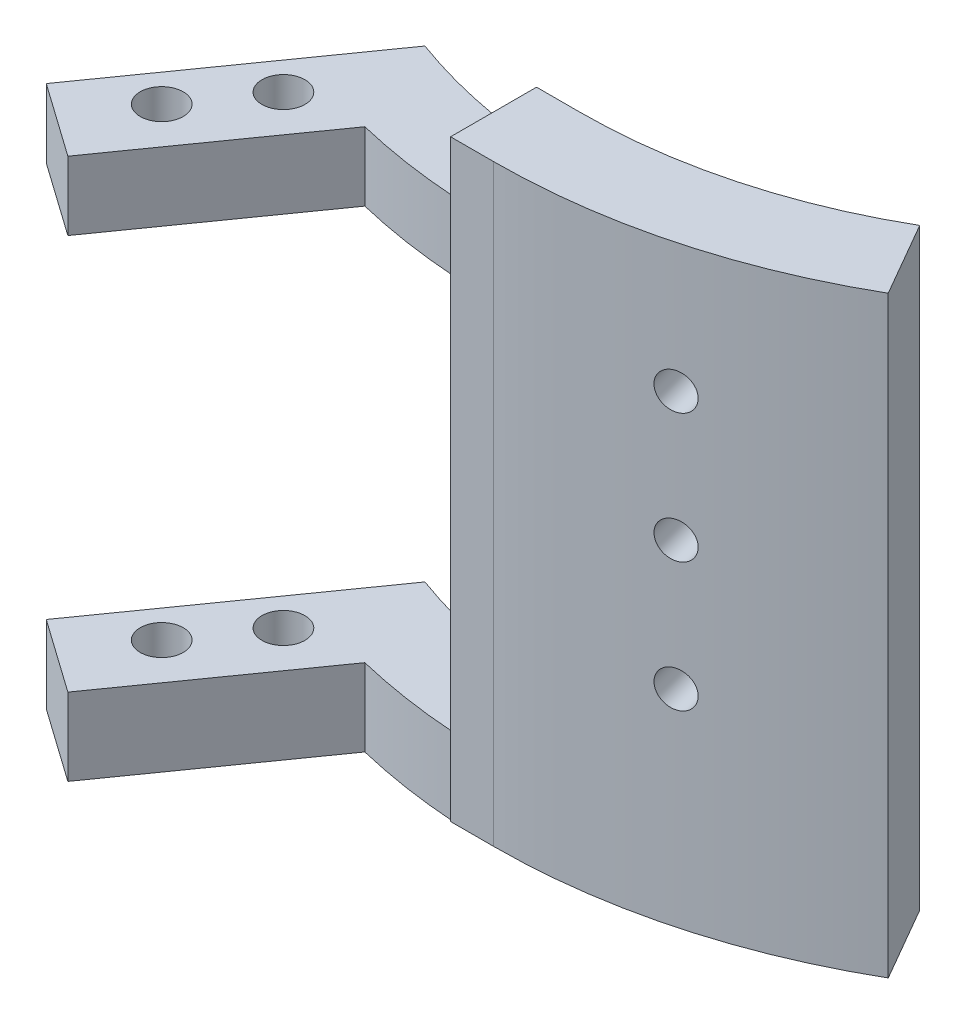
from build123d import *

# Parameters (mm, degrees)
BOSS_EXTRUDE2_DEPTH = 20
FILLET1_RADIUS      = 10
FILLET1_LENGTH      = 5
FILLET2_RADIUS      = 10
FILLET2_LENGTH      = 5
SKETCH5_R           = 1
SKETCH5_R_2         = 5.5
CUT_EXTRUDE5_DEPTH  = 69.007352544
CUT_EXTRUDE7_DEPTH  = 25
FILLET5_R           = 10
BOSS_EXTRUDE5_DEPTH = 60
SKETCH13_R          = 2.1
CUT_EXTRUDE8_DEPTH  = 60
CUT_EXTRUDE9_DEPTH  = 60
CUT_EXTRUDE10_DEPTH = 60
SKETCH17_R          = 2.5
BOSS_EXTRUDE6_DEPTH = 8
SKETCH18_R          = 2.5
BOSS_EXTRUDE7_DEPTH = 9


with BuildPart() as part:
    # Sketch1 → Boss-Extrude2 (new body)
    with BuildSketch(Plane.XY):
        Polygon((-25, 30), (25, 30), (25, -30), (-25, -30), (-25, -25), (-20, -25), (20, -25), (20, 25), (-20, 25), (-25, 25), align=None)
    extrude(amount=BOSS_EXTRUDE2_DEPTH)

    # Fillet1: full round fillet: the end face becomes a half cylinder, R = half its width
    fillet1_face = Plane((-25, 27.5, 10), x_dir=(0, -1, 0), z_dir=(-1, 0, 0))  # on the end face: x along it, z out of the body
    fillet1_slab = fillet1_face.offset(-FILLET1_RADIUS / 2) * Box(FILLET1_LENGTH, 2 * FILLET1_RADIUS, FILLET1_RADIUS, mode=Mode.PRIVATE)  # the body's end, R deep
    fillet1_round = Plane((-15, 27.5, 10), x_dir=(-1, 0, 0), z_dir=(0, -1, 0)) * Cylinder(FILLET1_RADIUS, FILLET1_LENGTH, mode=Mode.PRIVATE)  # its axis R under the face
    add(fillet1_slab - fillet1_round, mode=Mode.SUBTRACT)

    # Fillet2: full round fillet: the end face becomes a half cylinder, R = half its width
    fillet2_face = Plane((-25, -27.5, 10), x_dir=(0, -1, 0), z_dir=(-1, 0, 0))  # on the end face: x along it, z out of the body
    fillet2_slab = fillet2_face.offset(-FILLET2_RADIUS / 2) * Box(FILLET2_LENGTH, 2 * FILLET2_RADIUS, FILLET2_RADIUS, mode=Mode.PRIVATE)  # the body's end, R deep
    fillet2_round = Plane((-15, -27.5, 10), x_dir=(-1, 0, 0), z_dir=(0, -1, 0)) * Cylinder(FILLET2_RADIUS, FILLET2_LENGTH, mode=Mode.PRIVATE)  # its axis R under the face
    add(fillet2_slab - fillet2_round, mode=Mode.SUBTRACT)

    # Sketch5 → Cut-Extrude5 (cut, through all)
    with BuildSketch(Plane(origin=(0, 30, 0), x_dir=(1, 0, 0), z_dir=(0, 1, 0))):
        with Locations(Location((-15, -3, 0), (0, 0, 180))):
            Circle(SKETCH5_R)
        with Locations(Location((-22, -10, 0), (0, 0, 180))):
            Circle(SKETCH5_R)
        with Locations(Location((-15, -17, 0), (0, 0, 180))):
            Circle(SKETCH5_R)
        with Locations(Location((-8, -10, 0), (0, 0, 180))):
            Circle(SKETCH5_R)
        with Locations(Location((-15, -10, 0), (0, 0, 180))):
            Circle(SKETCH5_R_2)
    extrude(amount=-CUT_EXTRUDE5_DEPTH, mode=Mode.SUBTRACT)

    # Sketch10 → Cut-Extrude7 (cut)
    with BuildSketch(Plane(origin=(25, 0, 0), x_dir=(0, 0, -1), z_dir=(1, 0, 0))):
        Polygon((-15, 28.180148829), (-15, -28.180148829), (-15, -30), (-20, -30), (-20, 30), (-15, 30), align=None)
        Polygon((-5, 28.180148829), (-5, -28.180148829), (-5, -30), (0, -30), (0, 30), (-5, 30), align=None)
    extrude(amount=-CUT_EXTRUDE7_DEPTH, mode=Mode.SUBTRACT)

    # Fillet5
    # the kernel refuses this fillet: 10 mm, written as the material it adds along each edge
    with BuildSketch(Plane(origin=(0, 25, 15), x_dir=(1, 0, 0), z_dir=(0, 1, 0)), Plane(origin=(0, -30, 15), x_dir=(1, 0, 0), z_dir=(0, 1, 0)), Plane(origin=(0, -25, 5), x_dir=(1, 0, 0), z_dir=(0, -1, 0))) as fillet5_piece_1:
        with BuildLine():
            CenterArc((8.660254038, -10), FILLET5_R, 90, 60)
            Line((0, -5), (-0.173205081, -4.9))
            ThreePointArc((-0.173205081, -4.9), (-0.2, -2.5), (-0.2, 0))
            Line((-0.2, 0), (0, 0.2))
            Line((0, 0.2), (8.660254038, 0.2))
            Line((8.660254038, 0.2), (8.660254038, 0))
        make_face()
    extrude(amount=5)
    with BuildSketch(Plane(origin=(0, 30, 5), x_dir=(0, 0, -1), z_dir=(0, -1, 0))) as fillet5_piece_2:
        with BuildLine():
            CenterArc((10, 8.660254038), FILLET5_R, 180, 60)
            Line((0, 8.660254038), (-0.2, 8.660254038))
            Line((-0.2, 8.660254038), (-0.2, 0))
            Line((-0.2, 0), (0, -0.2))
            ThreePointArc((0, -0.2), (2.5, -0.2), (4.9, -0.173205081))
            Line((4.9, -0.173205081), (5, 0))
        make_face()
    extrude(amount=5)

    # Sketch12 → Boss-Extrude5 (add)
    with BuildSketch(Plane.XZ.offset(30)):
        with BuildLine():
            Line((56.226298398, -3.359735054), (61.222506141, 5.302707337))
            ThreePointArc((61.222506141, 5.302707337), (43.74904955, 12.533728595), (25, 15))
            Line((25, 15), (25, 5))
            ThreePointArc((25, 5), (41.16297375, 2.873903962), (56.226298398, -3.359735054))
        make_face()
    extrude(amount=-BOSS_EXTRUDE5_DEPTH)

    # Sketch13 → Cut-Extrude8 (cut)
    with BuildSketch(Plane(origin=(2.920998947, 0, 10.910870277), x_dir=(-0.9659824633840055, 0, 0.2586075800021504), z_dir=(-0.2586075800021504, 0, -0.9659824633840055))):
        with Locations((-39.019497435, 15)):
            Circle(SKETCH13_R)
        with Locations((-39.019497435, 0)):
            Circle(SKETCH13_R)
        with Locations((-39.019497435, -15)):
            Circle(SKETCH13_R)
    extrude(amount=-CUT_EXTRUDE8_DEPTH, mode=Mode.SUBTRACT)

    # Sketch15 → Cut-Extrude9 (cut)
    with BuildSketch(Plane(origin=(0, 30, 0), x_dir=(1, 0, 0), z_dir=(0, 1, 0))):
        with BuildLine():
            Line((8.660254038, -5), (8.660254038, -15))
            ThreePointArc((8.660254038, -15), (-39.182795974, -10), (8.660254038, -5))
        make_face()
    extrude(amount=-CUT_EXTRUDE9_DEPTH, mode=Mode.SUBTRACT)

    # Sketch16 → Cut-Extrude10 (cut)
    with BuildSketch(Plane(origin=(0, 30, 0), x_dir=(1, 0, 0), z_dir=(0, 1, 0))):
        Polygon((-6.307906019, -33.220384693), (8.660254038, -15), (20.000254038, -15), (20.000254038, -5), (8.660254038, -5), (3.496355525, -1.350438774), (-14.790578774, -27.225295226), align=None)
    extrude(amount=-CUT_EXTRUDE10_DEPTH, mode=Mode.SUBTRACT)

    # Sketch17 → Boss-Extrude6 (add)
    # profile 1 of 2: a face of its own
    with BuildSketch(Plane(origin=(0, 16, 0), x_dir=(1, 0, 0), z_dir=(0, 1, 0))):
        Polygon((2.432023453, -2.661202229), (-1.062108246, -7.605177784), (-12.605177784, -23.937891754), (-14.882580853, -27.160273185), (-8.757813114, -31.488924262), (-6.307906019, -33.220384693), (7.998117102, -12.978265997), (11.006698288, -8.721313737), align=None)
        with Locations(Location((-6.090722034, -22.517234763, 0), (0, 0, 180))):
            Circle(SKETCH17_R, mode=Mode.SUBTRACT)
        with Locations(Location((-0.226842709, -14.220216066, 0), (0, 0, 180))):
            Circle(SKETCH17_R, mode=Mode.SUBTRACT)
    # profile 2 of 2: a face of its own
    with BuildSketch(Plane(origin=(0, 16, 0), x_dir=(1, 0, 0), z_dir=(0, 1, 0))):
        with BuildLine():
            Line((3.360713643, -1.347164296), (2.432023453, -2.661202229))
            Line((2.432023453, -2.661202229), (11.006698288, -8.721313737))
            Line((11.006698288, -8.721313737), (7.998117102, -12.978265997))
            ThreePointArc((7.998117102, -12.978265997), (13.960401245, -14.154569005), (20.000254038, -14.827398269))
            Line((20.000254038, -14.827398269), (20.000254038, -5))
            ThreePointArc((20.000254038, -5), (11.555844657, -3.741343444), (3.360713643, -1.347164296))
        make_face()
    extrude(amount=BOSS_EXTRUDE6_DEPTH)

    # Sketch18 → Boss-Extrude7 (add)
    with BuildSketch(Plane(origin=(0, -39, 0), x_dir=(1, 0, 0), z_dir=(0, 1, 0))):
        with BuildLine():
            Line((3.360713643, -1.347164296), (-14.882580853, -27.160273185))
            Line((-14.882580853, -27.160273185), (-6.307906019, -33.220384693))
            Line((-6.307906019, -33.220384693), (7.998117102, -12.978265997))
            ThreePointArc((7.998117102, -12.978265997), (13.960401245, -14.154569005), (20.000254038, -14.827398269))
            Line((20.000254038, -14.827398269), (20.000254038, -15))
            Line((20.000254038, -15), (25, -15))
            ThreePointArc((25, -15), (43.74904955, -12.533728595), (61.222506141, -5.302707337))
            Line((61.222506141, -5.302707337), (56.226298398, 3.359735054))
            ThreePointArc((56.226298398, 3.359735054), (41.16297375, -2.873903962), (25, -5))
            Line((25, -5), (20.000254038, -5))
            ThreePointArc((20.000254038, -5), (11.555844657, -3.741343444), (3.360713643, -1.347164296))
        make_face()
        with Locations(Location((-6.090722034, -22.517234763, 0), (0, 0, 180))):
            Circle(SKETCH18_R, mode=Mode.SUBTRACT)
        with Locations(Location((-0.226842709, -14.220216066, 0), (0, 0, 180))):
            Circle(SKETCH18_R, mode=Mode.SUBTRACT)
    extrude(amount=BOSS_EXTRUDE7_DEPTH)


solid = part.part
